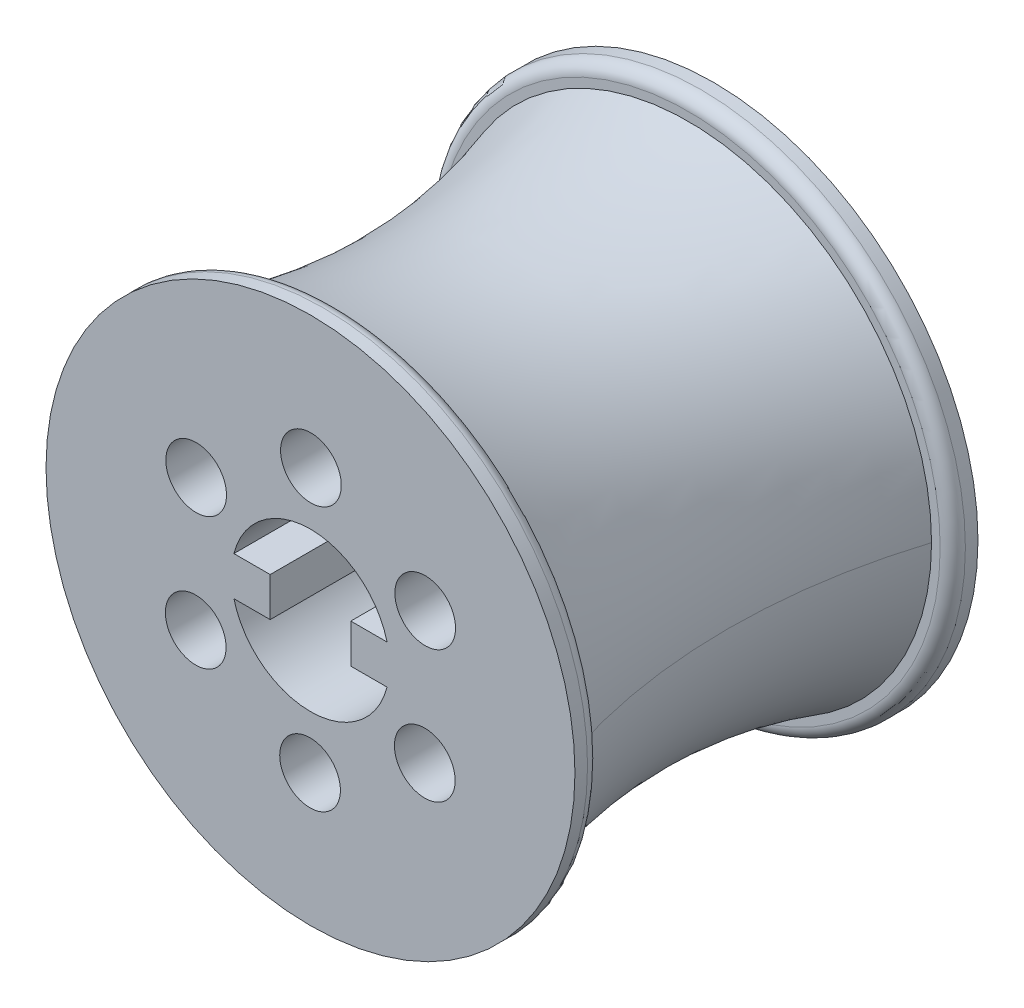
from build123d import *

# Parameters (mm, degrees)
SKETCH3_R           = 21
BOSS_EXTRUDE3_DEPTH = 32
CUT_EXTRUDE1_START  = -30
SKETCH4_R           = 21
SKETCH4_R_2         = 19.31273959
CUT_EXTRUDE1_DEPTH  = 28
SKETCH8_R           = 6.075
SKETCH8_R_2         = 2.409749928
CUT_EXTRUDE2_DEPTH  = 44.657759906
FILLET1_R           = 1
FILLET3_R           = 5
BOSS_EXTRUDE4_START = -17
SKETCH11_R          = 8
BOSS_EXTRUDE4_DEPTH = 15
SKETCH12_W          = 6.25
SKETCH12_H          = 3.5
BOSS_EXTRUDE5_DEPTH = 17
SKETCH15_OUTSIDE_W  = 57.494
SKETCH15_OUTSIDE_H  = 57.494
SKETCH15_OUTSIDE_R  = 21
CUT_EXTRUDE3_DEPTH  = 17


with BuildPart() as part:
    # Sketch3 → Boss-Extrude3 (new body)
    with BuildSketch(Plane.XY):
        Circle(SKETCH3_R)
    extrude(amount=BOSS_EXTRUDE3_DEPTH)

    # Sketch4 → Cut-Extrude1 (cut)
    with BuildSketch(Plane.XY.offset(32).offset(CUT_EXTRUDE1_START)):
        Circle(SKETCH4_R)
        Circle(SKETCH4_R_2, mode=Mode.SUBTRACT)
    extrude(amount=CUT_EXTRUDE1_DEPTH, mode=Mode.SUBTRACT)

    # Cut-Sweep1: sweep along a curve in space
    with BuildLine() as cut_sweep1_path:
        ThreePointArc((19.31273959, 0, 2), (13.656169127, 13.656169127, 2), (0, 19.31273959, 2))
        ThreePointArc((0, 19.31273959, 2), (-13.656169127, 13.656169127, 2), (-19.31273959, 0, 2))
        ThreePointArc((-19.31273959, 0, 2), (-13.656169127, -13.656169127, 2), (0, -19.31273959, 2))
        ThreePointArc((0, -19.31273959, 2), (13.656169127, -13.656169127, 2), (19.31273959, 0, 2))
    # Sketch7 → Cut-Sweep1 (sweep, cut)
    with BuildSketch(Plane(origin=(0, 0, 0), x_dir=(1, 0, 0), z_dir=(0, 1, 0))):
        with BuildLine():
            Line((-19.31273959, -2), (-19.31273959, -30))
            ThreePointArc((-19.31273959, -30), (-17.146485403, -16), (-19.31273959, -2))
        make_face()
    sweep(path=cut_sweep1_path.line, mode=Mode.SUBTRACT)

    # Sketch8 → Cut-Extrude2 (cut, through all)
    with BuildSketch(Plane(origin=(0, 0, 0), x_dir=(-1, 0, 0), z_dir=(0, 0, -1))):
        Circle(SKETCH8_R)
        with Locations((9.076330186, 5.279334971)):
            Circle(SKETCH8_R_2)
        with Locations((-0.033873107, 10.5)):
            Circle(SKETCH8_R_2)
        with Locations((9.110203293, -5.220665029)):
            Circle(SKETCH8_R_2)
        with Locations((0.033873107, -10.5)):
            Circle(SKETCH8_R_2)
        with Locations((-9.076330186, -5.279334971)):
            Circle(SKETCH8_R_2)
        with Locations((-9.110203293, 5.220665029)):
            Circle(SKETCH8_R_2)
    extrude(amount=-CUT_EXTRUDE2_DEPTH, mode=Mode.SUBTRACT)

    # Sketch10 → Cut-Revolve1 (revolve, cut)
    with BuildSketch(Plane(origin=(0, 0, 0), x_dir=(1, 0, 0), z_dir=(0, 1, 0))):
        Polygon((-6.075, 0), (-15.24176478, -2.795793959), (-19.075, 0), align=None)
    revolve(axis=Axis((0, 0, 2), (0, 0, 1)), mode=Mode.SUBTRACT)

    # Fillet1
    fillet1_edges = [part.edges().sort_by_distance(p)[0] for p in [
        (-21, 0, 2),
        (-21, 0, 30),
    ]]
    fillet(fillet1_edges, radius=FILLET1_R)

    # Fillet3
    # the kernel refuses this fillet: 5 mm, written as the material it adds along each edge
    with BuildSketch(Plane(origin=(0, 0, 2.795793959), x_dir=(-1, 0, 0), z_dir=(0, 1, 0))) as fillet3_piece_1_section:
        with BuildLine():
            CenterArc((15.24176478 - FILLET3_R * 0.185863598659, -FILLET3_R * 1.10216314652), FILLET3_R, 53.894625959, 53.066683648)
            Line((15.24176478 - FILLET3_R * 0.47758946832, -FILLET3_R * 0.145661177375), (15.24176478, 0))
            Line((15.24176478, 0), (15.24176478 + FILLET3_R * 0.403408541274, -FILLET3_R * 0.294228529669))
        make_face()
    fillet3_piece_1 = revolve(axis=Axis((0, 0, 2.795793959), (0, 0, 1)), mode=Mode.PRIVATE)
    fillet3_piece_1 = fillet3_piece_1 - Plane(origin=(-9.110203293, -5.220665029, 2.265856679), x_dir=(-1, 0, 0), z_dir=(0, 0, -1)) * Cylinder(2.409749928, 70, mode=Mode.PRIVATE)
    fillet3_piece_1 = fillet3_piece_1 - Plane(origin=(-0.033873107, -10.5, 2.265856679), x_dir=(-1, 0, 0), z_dir=(0, 0, -1)) * Cylinder(2.409749928, 70, mode=Mode.PRIVATE)
    fillet3_piece_1 = fillet3_piece_1 - Plane(origin=(9.076330186, -5.279334971, 2.265856679), x_dir=(-1, 0, 0), z_dir=(0, 0, -1)) * Cylinder(2.409749928, 70, mode=Mode.PRIVATE)
    fillet3_piece_1 = fillet3_piece_1 - Plane(origin=(9.110203293, 5.220665029, 2.265856679), x_dir=(-1, 0, 0), z_dir=(0, 0, -1)) * Cylinder(2.409749928, 70, mode=Mode.PRIVATE)
    fillet3_piece_1 = fillet3_piece_1 - Plane(origin=(-9.076330186, 5.279334971, 2.265856679), x_dir=(-1, 0, 0), z_dir=(0, 0, -1)) * Cylinder(2.409749928, 70, mode=Mode.PRIVATE)
    fillet3_piece_1 = fillet3_piece_1 - Plane(origin=(0.033873107, 10.5, 2.265856679), x_dir=(-1, 0, 0), z_dir=(0, 0, -1)) * Cylinder(2.409749928, 70, mode=Mode.PRIVATE)
    add(fillet3_piece_1)

    # Sketch11 → Boss-Extrude4 (add)
    with BuildSketch(Plane.XY.offset(32).offset(BOSS_EXTRUDE4_START)):
        Circle(SKETCH11_R)
    extrude(amount=-BOSS_EXTRUDE4_DEPTH)

    # Sketch12 → Boss-Extrude5 (add)
    with BuildSketch(Plane.XY.offset(32)):
        with Locations((-6.125, 0)):
            Rectangle(SKETCH12_W, SKETCH12_H)
        with Locations((6.125, 0)):
            Rectangle(SKETCH12_W, SKETCH12_H)
    extrude(amount=-BOSS_EXTRUDE5_DEPTH)

    # Sketch15 outside → Cut-Extrude3 (cut)
    # profile 1 of 2: a face of its own
    with BuildSketch(Plane.XY.offset(32)):
        Rectangle(SKETCH15_OUTSIDE_W, SKETCH15_OUTSIDE_H)
        Circle(SKETCH15_OUTSIDE_R, mode=Mode.SUBTRACT)
    # profile 2 of 2: a face of its own
    with BuildSketch(Plane.XY.offset(32)):
        with BuildLine():
            Line((-6.080553018, 1.55), (-3.2, 1.55))
            Line((-3.2, 1.55), (-3.2, -1.55))
            Line((-3.2, -1.55), (-6.080553018, -1.55))
            ThreePointArc((-6.080553018, -1.55), (0, -6.275), (6.080553018, -1.55))
            Line((6.080553018, -1.55), (3.2, -1.55))
            Line((3.2, -1.55), (3.2, 1.55))
            Line((3.2, 1.55), (6.080553018, 1.55))
            ThreePointArc((6.080553018, 1.55), (0, 6.275), (-6.080553018, 1.55))
        make_face()
    extrude(amount=-CUT_EXTRUDE3_DEPTH, mode=Mode.SUBTRACT)


solid = part.part
